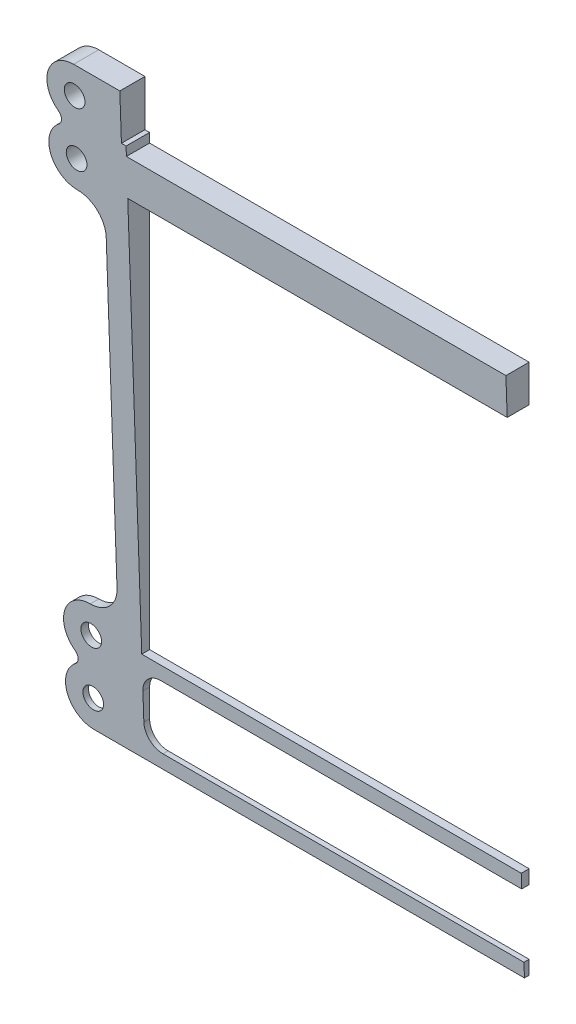
from build123d import *

# Parameters (mm, degrees)
BOSS_EXTRUDE1_OUTLINE_R = 3.556
BOSS_EXTRUDE1_OUTLINE_W = 260.9469
BOSS_EXTRUDE1_OUTLINE_H = 138.1252
BOSS_EXTRUDE1_DEPTH     = 76.2
CUT_EXTRUDE1_DEPTH      = 355.32482824
CUT_EXTRUDE1_DEPTH_BACK = 355.32482824
FILLET1_R               = 2.54
SKETCH7_W               = 260.9469
SKETCH7_H               = 22.1996
CUT_EXTRUDE2_DEPTH      = 347.152897849
FILLET2_R               = 6.35
SKETCH8_W               = 217.439036591
SKETCH8_H               = 235.521960295
CUT_EXTRUDE4_DEPTH      = 347.144751077


# Read off the part's stored shape, not the designer's step: Boss-Extrude1
with BuildPart() as part:
    # Boss-Extrude1 outline → Boss-Extrude1 (new body)
    with BuildSketch(Plane.XY):
        with BuildLine():
            Line((-286.3596, -22.225), (9.525, -22.225))
            ThreePointArc((9.525, -22.225), (19.05, -12.7), (9.525, -3.175))
            ThreePointArc((9.525, -3.175), (19.05, 6.35), (9.525, 15.875))
            ThreePointArc((9.525, 15.875), (2.789807909, 18.664807909), (0, 25.4))
            Line((0, 25.4), (0, 131.7752))
            ThreePointArc((0, 131.7752), (2.789807909, 138.510392091), (9.525, 141.3002))
            ThreePointArc((9.525, 141.3002), (19.05, 150.8252), (9.525, 160.3502))
            ThreePointArc((9.525, 160.3502), (19.05, 169.8752), (9.525, 179.4002))
            Line((9.525, 179.4002), (-6.35, 179.4002))
            Line((-6.35, 179.4002), (-6.35, 163.5252))
            Line((-6.35, 163.5252), (-7.9502, 163.5252))
            Line((-7.9502, 163.5252), (-7.9502, 160.3502))
            Line((-7.9502, 160.3502), (-268.9098, 160.3502))
            Line((-268.9098, 160.3502), (-268.9098, 163.5252))
            Line((-268.9098, 163.5252), (-270.51, 163.5252))
            Line((-270.51, 163.5252), (-270.51, 179.4002))
            Line((-270.51, 179.4002), (-286.385, 179.4002))
            ThreePointArc((-286.385, 179.4002), (-295.91, 169.8752), (-286.385, 160.3502))
            ThreePointArc((-286.385, 160.3502), (-295.897297883, 150.818850004), (-286.3723, 141.3002))
            ThreePointArc((-286.3723, 141.3002), (-279.637107909, 138.510392091), (-276.8473, 131.7752))
            Line((-276.8473, 131.7752), (-276.8473, 25.4))
            ThreePointArc((-276.8473, 25.4), (-279.637107909, 18.664807909), (-286.3723, 15.875))
            ThreePointArc((-286.3723, 15.875), (-295.8973, 6.35), (-286.3723, -3.175))
            ThreePointArc((-286.3723, -3.175), (-295.884597883, -12.706349996), (-286.3596, -22.225))
        make_face()
        with Locations((-286.3596, -12.7)):
            Circle(BOSS_EXTRUDE1_OUTLINE_R, mode=Mode.SUBTRACT)
        with Locations((-286.3723, 6.35)):
            Circle(BOSS_EXTRUDE1_OUTLINE_R, mode=Mode.SUBTRACT)
        with Locations((9.525, -12.7)):
            Circle(BOSS_EXTRUDE1_OUTLINE_R, mode=Mode.SUBTRACT)
        with Locations((9.525, 6.35)):
            Circle(BOSS_EXTRUDE1_OUTLINE_R, mode=Mode.SUBTRACT)
        with Locations((-286.3723, 150.8252)):
            Circle(BOSS_EXTRUDE1_OUTLINE_R, mode=Mode.SUBTRACT)
        with Locations((-286.385, 169.8752)):
            Circle(BOSS_EXTRUDE1_OUTLINE_R, mode=Mode.SUBTRACT)
        with Locations((-138.42365, 78.5876)):
            Rectangle(BOSS_EXTRUDE1_OUTLINE_W, BOSS_EXTRUDE1_OUTLINE_H, mode=Mode.SUBTRACT)
        with Locations((9.525, 150.8252)):
            Circle(BOSS_EXTRUDE1_OUTLINE_R, mode=Mode.SUBTRACT)
        with Locations((9.525, 169.8752)):
            Circle(BOSS_EXTRUDE1_OUTLINE_R, mode=Mode.SUBTRACT)
    extrude(amount=BOSS_EXTRUDE1_DEPTH)

    # Sketch5 → Cut-Extrude1 (cut, two sides: drawn at the far end of the back side and taken through both)
    with BuildSketch(Plane.ZY.offset(276.8473).offset(-CUT_EXTRUDE1_DEPTH_BACK)):
        Polygon((1.6002, -22.225), (8.641107133, 179.4002), (76.2, 179.4002), (76.2, -22.225), align=None)
    extrude(amount=CUT_EXTRUDE1_DEPTH + CUT_EXTRUDE1_DEPTH_BACK, mode=Mode.SUBTRACT)

    # Fillet1
    fillet1_edges = [part.edges().sort_by_distance(p)[0] for p in [
        (-286.385, 160.3502, 3.987933237),
        (-286.3723, -3.175, 1.132720329),
        (9.525, -3.175, 1.132720329),
        (9.525, 160.3502, 3.987933237),
    ]]
    fillet(fillet1_edges, radius=FILLET1_R)

    # Sketch7 → Cut-Extrude2 (cut, through all)
    with BuildSketch(Plane(origin=(0, 0, 0), x_dir=(-1, 0, 0), z_dir=(0, 0, -1))):
        with Locations((138.42365, -6.35)):
            Rectangle(SKETCH7_W, SKETCH7_H)
    extrude(amount=-CUT_EXTRUDE2_DEPTH, mode=Mode.SUBTRACT)

    # Fillet2
    fillet2_edges = [part.edges().sort_by_distance(p)[0] for p in [
        (-268.8971, 4.7498, 1.271090386),
        (-268.8971, -17.4498, 0.883476829),
        (-7.9502, -17.4498, 0.883476829),
        (-7.9502, 4.7498, 1.271090386),
    ]]
    fillet(fillet2_edges, radius=FILLET2_R)

    # Sketch8 → Cut-Extrude4 (cut, through all)
    with BuildSketch(Plane(origin=(0, -0.082881646, 2.373419811), x_dir=(1, 0, 0), z_dir=(0, -0.03489949670250444, 0.9993908270190958))):
        with Locations((-29.704131704, 74.917246318)):
            Rectangle(SKETCH8_W, SKETCH8_H)
    extrude(amount=-CUT_EXTRUDE4_DEPTH, mode=Mode.SUBTRACT)


solid = part.part
